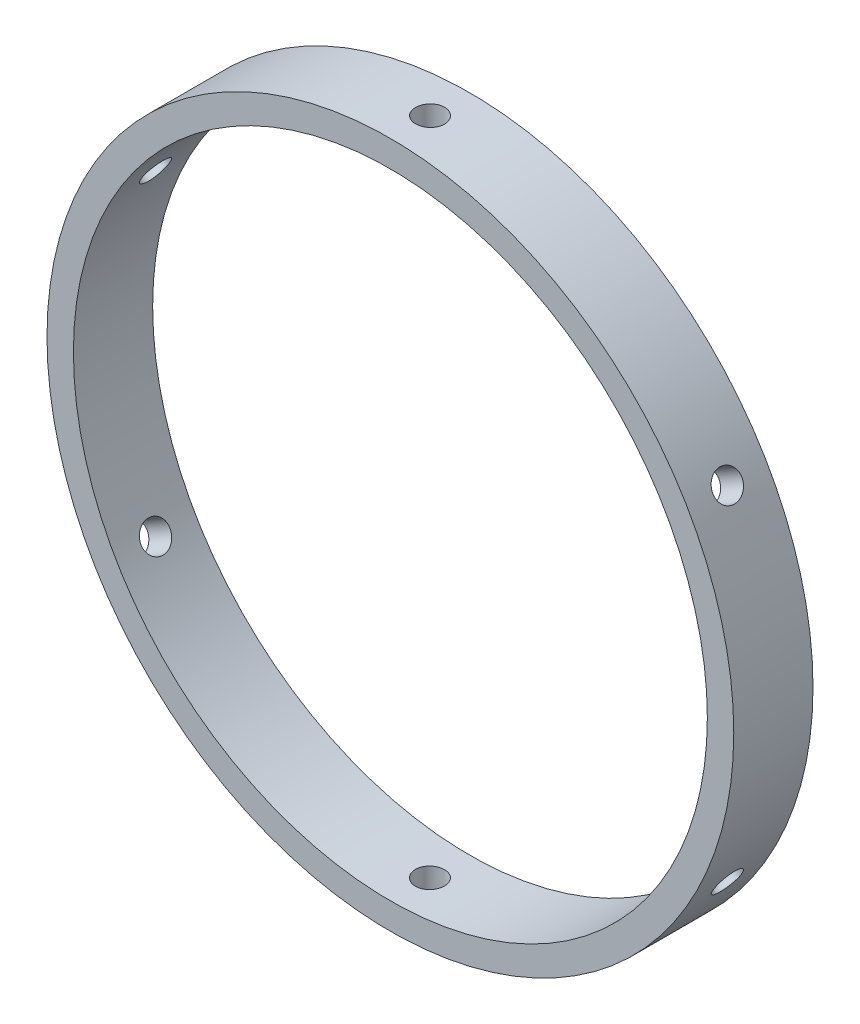
from build123d import *

# Parameters (mm, degrees)
SKETCH1_R           = 82.55
SKETCH1_R_2         = 76.2
BOSS_EXTRUDE1_DEPTH = 19.05
SKETCH2_R           = 3.478244762
CUT_EXTRUDE1_DEPTH  = 119.287393665
CIRPATTERN1_COUNT   = 6


with BuildPart() as part:
    # Sketch1 → Boss-Extrude1 (new body)
    with BuildSketch(Plane.XY):
        Circle(SKETCH1_R)
        Circle(SKETCH1_R_2, mode=Mode.SUBTRACT)
    extrude(amount=BOSS_EXTRUDE1_DEPTH)

    # Sketch2 → Cut-Extrude1 (cut, through all)
    with BuildSketch(Plane(origin=(0, 0, 0), x_dir=(1, 0, 0), z_dir=(0, 1, 0))):
        with Locations((0, -9.525)):
            Circle(SKETCH2_R)
    cut_extrude1 = extrude(amount=-CUT_EXTRUDE1_DEPTH, mode=Mode.SUBTRACT)

    # CirPattern1: Cut-Extrude1 ×6 about axis
    cirpattern1_axis = Axis((0, 0, 2.080715754), (0, 0, 1))
    for i in range(1, CIRPATTERN1_COUNT):
        add(cut_extrude1.rotate(cirpattern1_axis, i * 360 / CIRPATTERN1_COUNT), mode=Mode.SUBTRACT)


solid = part.part
